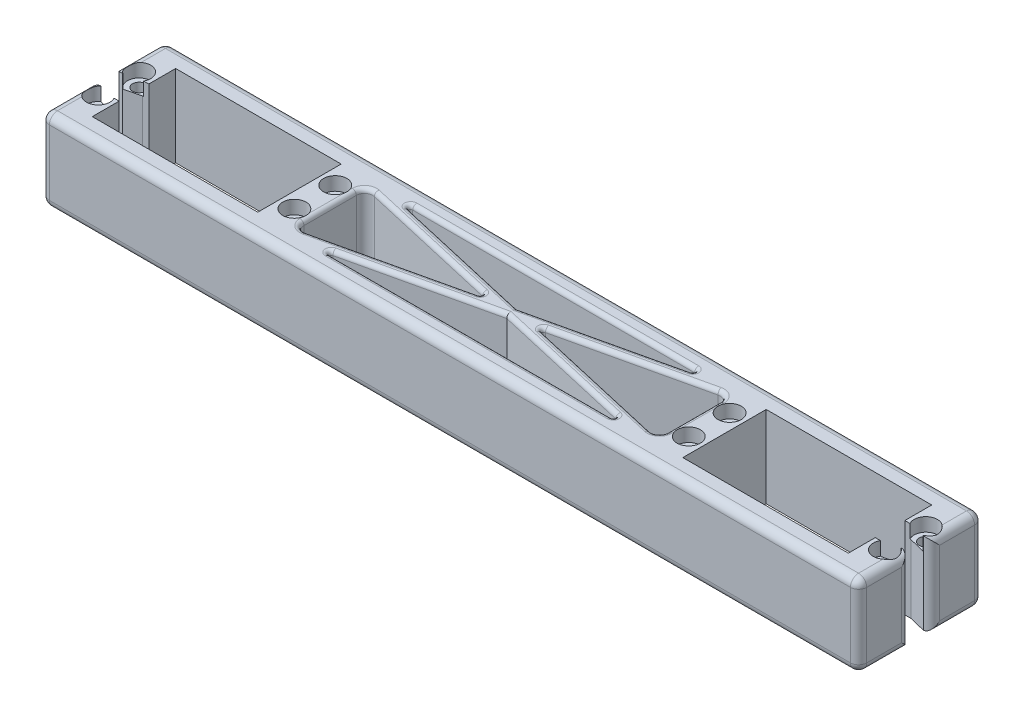
from build123d import *

# Parameters (mm, degrees)
SKETCH1_W           = 200
SKETCH1_H           = 30.4
BOSS_EXTRUDE1_DEPTH = 20
SKETCH2_W           = 40.5
SKETCH2_H           = 20.4
CUT_EXTRUDE1_DEPTH  = 20
SKETCH3_R           = 1.6
CUT_EXTRUDE2_DEPTH  = 175.072118675
CUT_EXTRUDE3_DEPTH  = 175.072118675
SKETCH5_R           = 1.6
CUT_EXTRUDE4_DEPTH  = 175.072118675
SKETCH6_W           = 89
SKETCH6_H           = 20.4
CUT_EXTRUDE5_DEPTH  = 175.072118675
BOSS_EXTRUDE2_DEPTH = 20
FILLET1_R           = 2
FILLET2_R           = 0.5
FILLET3_R           = 1
SKETCH8_R           = 2.85
CUT_EXTRUDE6_DEPTH  = 3.3


with BuildPart() as part:
    # Sketch1 → Boss-Extrude1 (new body)
    with BuildSketch(Plane(origin=(0, 0, 0), x_dir=(1, 0, 0), z_dir=(0, 1, 0))):
        with Locations((72.25, 0)):
            Rectangle(SKETCH1_W, SKETCH1_H)
    extrude(amount=BOSS_EXTRUDE1_DEPTH)

    # Sketch2 → Cut-Extrude1 (cut)
    with BuildSketch(Plane(origin=(0, 20, 0), x_dir=(1, 0, 0), z_dir=(0, 1, 0))):
        Rectangle(SKETCH2_W, SKETCH2_H)
    extrude(amount=-CUT_EXTRUDE1_DEPTH, mode=Mode.SUBTRACT)

    # Sketch3 → Cut-Extrude2 (cut, through all)
    with BuildSketch(Plane(origin=(0, 20, 0), x_dir=(1, 0, 0), z_dir=(0, 1, 0))):
        with Locations(Location((-24, 5, 0), (0, 0, 270))):
            Circle(SKETCH3_R)
        with Locations(Location((-24, -5, 0), (0, 0, 270))):
            Circle(SKETCH3_R)
        with Locations(Location((24, -5, 0), (0, 0, 270))):
            Circle(SKETCH3_R)
        with Locations(Location((24, 5, 0), (0, 0, 270))):
            Circle(SKETCH3_R)
    extrude(amount=-CUT_EXTRUDE2_DEPTH, mode=Mode.SUBTRACT)

    # Sketch4 → Cut-Extrude3 (cut, through all)
    with BuildSketch(Plane(origin=(0, 20, 0), x_dir=(1, 0, 0), z_dir=(0, 1, 0))):
        Polygon((-20.25, 3.625), (-20.25, -3.625), (-21.75, -3.625), (-25.75, -2.65), (-27.75, -2.65), (-27.75, 2.65), (-25.75, 2.65), (-21.75, 3.625), align=None)
    extrude(amount=-CUT_EXTRUDE3_DEPTH, mode=Mode.SUBTRACT)

    # Sketch5 → Cut-Extrude4 (cut, through all)
    with BuildSketch(Plane(origin=(0, 20, 0), x_dir=(1, 0, 0), z_dir=(0, 1, 0))):
        with Locations(Location((-24, -5, 0), (0, 0, 270))):
            Circle(SKETCH5_R)
        with Locations(Location((24, -5, 0), (0, 0, 270))):
            Circle(SKETCH5_R)
        with Locations(Location((24, 5, 0), (0, 0, 270))):
            Circle(SKETCH5_R)
        with Locations(Location((-24, 5, 0), (0, 0, 270))):
            Circle(SKETCH5_R)
        with Locations(Location((168.5, 5, 0), (0, 0, 90))):
            Circle(SKETCH5_R)
        with Locations(Location((168.5, -5, 0), (0, 0, 90))):
            Circle(SKETCH5_R)
        with Locations(Location((120.5, 5, 0), (0, 0, 90))):
            Circle(SKETCH5_R)
        with Locations(Location((120.5, -5, 0), (0, 0, 90))):
            Circle(SKETCH5_R)
        Polygon((164.75, 3.625), (164.75, 10.2), (124.25, 10.2), (124.25, -10.2), (164.75, -10.2), (164.75, -3.625), (166.25, -3.625), (170.25, -2.65), (172.25, -2.65), (172.25, 2.65), (170.25, 2.65), (166.25, 3.625), align=None)
        Polygon((-27.75, 2.65), (-27.75, -2.65), (-25.75, -2.65), (-21.75, -3.625), (-20.25, -3.625), (-20.25, -10.2), (20.25, -10.2), (20.25, 10.2), (-20.25, 10.2), (-20.25, 3.625), (-21.75, 3.625), (-25.75, 2.65), align=None)
    extrude(amount=-CUT_EXTRUDE4_DEPTH, mode=Mode.SUBTRACT)

    # Sketch6 → Cut-Extrude5 (cut, through all)
    with BuildSketch(Plane(origin=(0, 20, 0), x_dir=(1, 0, 0), z_dir=(0, 1, 0))):
        with Locations((72.25, 0)):
            Rectangle(SKETCH6_W, SKETCH6_H)
    extrude(amount=-CUT_EXTRUDE5_DEPTH, mode=Mode.SUBTRACT)

    # Sketch7 → Boss-Extrude2 (add)
    with BuildSketch(Plane(origin=(0, 20, 0), x_dir=(1, 0, 0), z_dir=(0, 1, 0))):
        Polygon((27.75, -8.917583567), (66.655143993, 0), (27.75, 8.917583567), (27.75, 10.2), (33.344856007, 10.2), (72.25, 1.282416433), (111.155143993, 10.2), (116.75, 10.2), (116.75, 8.917583567), (77.844856007, 0), (116.75, -8.917583567), (116.75, -10.2), (111.155143993, -10.2), (72.25, -1.282416433), (33.344856007, -10.2), (27.75, -10.2), align=None)
    extrude(amount=-BOSS_EXTRUDE2_DEPTH)

    # Fillet1
    fillet1_edges = [part.edges().sort_by_distance(p)[0] for p in [
        (172.25, 0, -8.925),
        (172.25, 10, -2.65),
        (172.25, 20, -8.925),
        (172.25, 20, 8.925),
        (172.25, 10, 2.65),
        (172.25, 0, 8.925),
        (-27.75, 0, -8.925),
        (-27.75, 20, -8.925),
        (-27.75, 10, -2.65),
        (-27.75, 20, 8.925),
        (-27.75, 0, 8.925),
        (-27.75, 10, 2.65),
        (172.25, 10, -15.2),
        (72.25, 20, -15.2),
        (-27.75, 10, -15.2),
        (72.25, 0, -15.2),
        (-27.75, 10, 15.2),
        (72.25, 20, 15.2),
        (172.25, 10, 15.2),
        (72.25, 0, 15.2),
        (27.75, 10, 8.917583567),
        (27.75, 10, -8.917583567),
        (116.75, 10, -8.917583567),
        (116.75, 10, 8.917583567),
    ]]
    fillet(fillet1_edges, radius=FILLET1_R - 0.0001)  # a hair under: the kernel refuses the full size

    # Fillet2
    fillet2_edges = [part.edges().sort_by_distance(p)[0] for p in [
        (66.655143993, 10, 0),
        (33.344856007, 10, -10.2),
        (111.155143993, 10, -10.2),
        (77.844856007, 10, 0),
        (111.155143993, 10, 10.2),
        (33.344856007, 10, 10.2),
    ]]
    fillet(fillet2_edges, radius=FILLET2_R)

    # Fillet3
    fillet3_edges = [part.edges().sort_by_distance(p)[0] for p in [
        (89.548769399, 20, 5.247527621),
        (54.951230601, 20, -5.247527621),
        (89.548769399, 0, -5.247527621),
        (54.951230601, 0, 5.247527621),
        (116.75, 0, 0),
        (97.137185985, 0, -4.422062152),
        (27.75, 0, 0),
        (47.362814015, 0, 4.422062152),
        (116.75, 20, 0),
        (97.137185985, 20, 4.422062152),
        (27.75, 20, 0),
        (47.362814015, 20, -4.422062152),
        (28.503703521, 20, 7.971575132),
        (28.503703521, 0, 7.971575132),
        (28.503703521, 20, -7.971575132),
        (28.503703521, 0, -7.971575132),
        (115.996296479, 20, -7.971575132),
        (115.996296479, 0, -7.971575132),
        (115.996296479, 20, 7.971575132),
        (115.996296479, 0, 7.971575132),
        (54.951230601, 0, -5.247527621),
        (72.25, 20, -10.2),
        (72.25, 0, -10.2),
        (72.25, 20, 10.2),
        (72.25, 0, 10.2),
        (54.951230601, 20, 5.247527621),
        (89.548769399, 0, 5.247527621),
        (89.548769399, 20, -5.247527621),
        (97.137185985, 0, 4.422062152),
        (97.137185985, 20, -4.422062152),
        (47.362814015, 0, -4.422062152),
        (47.362814015, 20, 4.422062152),
        (37.267340708, 20, -9.756211229),
        (37.267340708, 0, -9.756211229),
        (37.267340708, 20, 9.756211229),
        (37.267340708, 0, 9.756211229),
        (107.232659292, 20, 9.756211229),
        (107.232659292, 0, 9.756211229),
        (107.232659292, 20, -9.756211229),
        (107.232659292, 0, -9.756211229),
        (79.582798409, 20, 0),
        (79.582798409, 0, 0),
        (64.917201591, 20, 0),
        (64.917201591, 0, 0),
    ]]
    fillet(fillet3_edges, radius=FILLET3_R)

    # Sketch8 → Cut-Extrude6 (cut)
    with BuildSketch(Plane(origin=(0, 20, 0), x_dir=(1, 0, 0), z_dir=(0, 1, 0))):
        with Locations((-24, 5)):
            Circle(SKETCH8_R)
        with Locations((-24, -5)):
            Circle(SKETCH8_R)
        with Locations(Location((24, 5, 0), (0, 0, 270))):
            Circle(SKETCH8_R)
        with Locations(Location((24, -5, 0), (0, 0, 270))):
            Circle(SKETCH8_R)
        with Locations(Location((120.5, 5, 0), (0, 0, 270))):
            Circle(SKETCH8_R)
        with Locations(Location((120.5, -5, 0), (0, 0, 270))):
            Circle(SKETCH8_R)
        with Locations((168.5, 5)):
            Circle(SKETCH8_R)
        with Locations((168.5, -5)):
            Circle(SKETCH8_R)
    extrude(amount=-CUT_EXTRUDE6_DEPTH, mode=Mode.SUBTRACT)


solid = part.part
